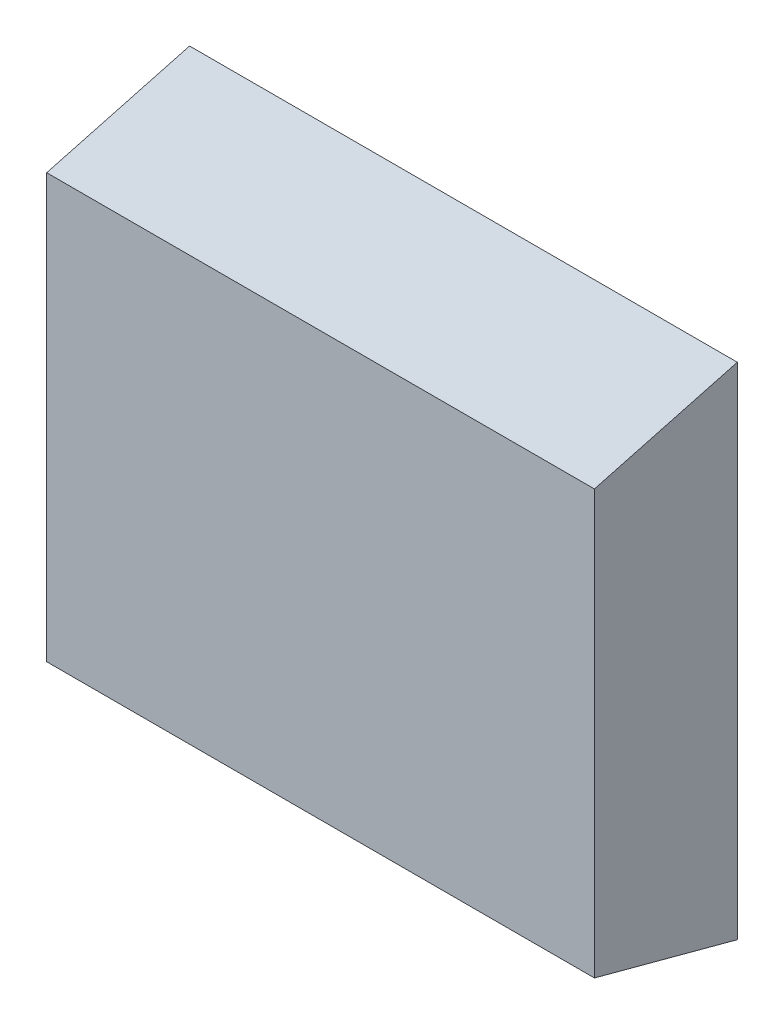
from build123d import *

# Parameters (mm, degrees)
ESBO_O1_W                = 34.5
ESBO_O1_H                = 31.5
RESSALTO_EXTRUS_O1_DEPTH = 9
CHANFRO1_SIZE            = 9
CHANFRO1_SIZE_2          = 2.411542732


with BuildPart() as part:
    # Esboço1 → Ressalto-extrusão1 (new body)
    with BuildSketch(Plane.XY):
        Rectangle(ESBO_O1_W, ESBO_O1_H)
    extrude(amount=RESSALTO_EXTRUS_O1_DEPTH)

    # Chanfro1
    # the kernel refuses this chamfer: 9, 2.411542732 mm, written as the material it takes off along each edge
    with BuildSketch(Plane(origin=(-40.620494132, -15.75, 9), x_dir=(0, -0.009967146577156494, -0.9999503267608394), z_dir=(1, 0, 0)), Plane(origin=(40.620494132, 15.75, 9), x_dir=(0, 0.009967146577156494, -0.9999503267608394), z_dir=(-1, 0, 0))) as chanfro1_piece_1:
        Polygon((CHANFRO1_SIZE * 0.999950326761, CHANFRO1_SIZE * 0.00996714657716), (-CHANFRO1_SIZE_2 * 0.00996714657666, CHANFRO1_SIZE_2 * 0.999950326711), (0, 0), align=None)
    extrude(amount=81.240988264, mode=Mode.SUBTRACT)


solid = part.part
